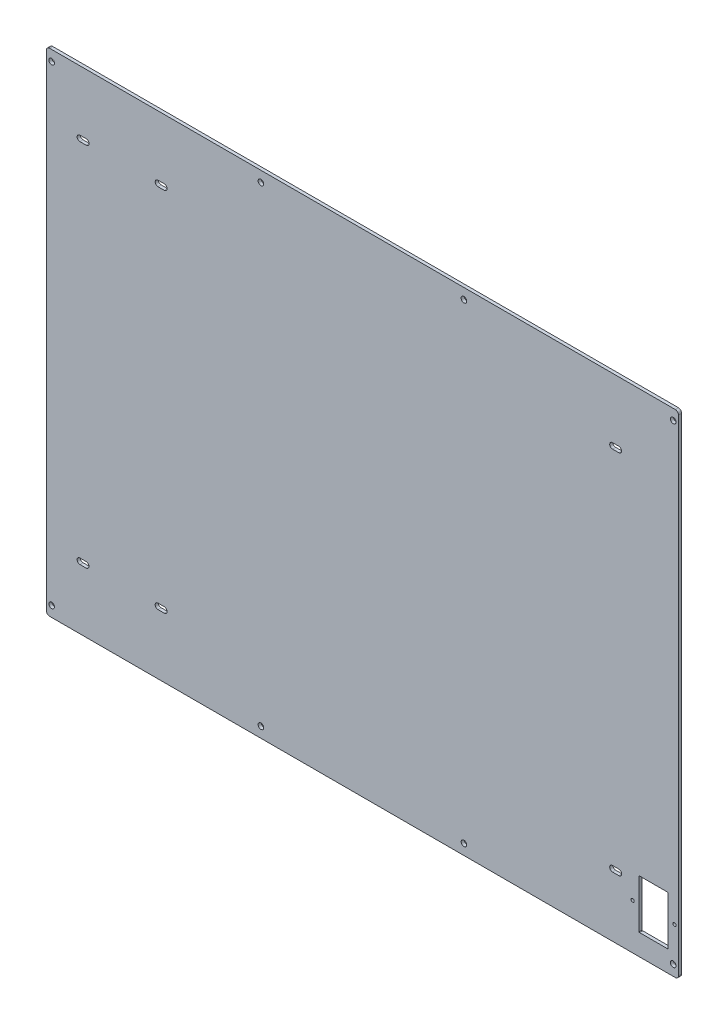
from build123d import *

# Parameters (mm, degrees)
SKETCH1_W              = 604
SKETCH1_H              = 470
BOSS_EXTRUDE1_DEPTH    = 3
FILLET1_R              = 3
M5_CLEARANCE_HOLE1_D   = 5.5
SKETCH5_R              = 1.6
SKETCH5_W              = 28
SKETCH5_H              = 47
CUT_EXTRUDE1_DEPTH     = 766.326727614
FILLET2_R              = 0.5
CUT_EXTRUDE5_DEPTH     = 766.326727614
MOVE_FACE1_OUTLINE_R   = 2.75
MOVE_FACE1_OUTLINE_R_2 = 2.6738
MOVE_FACE1_OUTLINE_R_3 = 1.6
MOVE_FACE1_OUTLINE_R_4 = 1.5238
MOVE_FACE1_DEPTH       = 3


# Read off the part's stored shape, not the designer's step: Move Face1
with BuildPart() as part:
    # Sketch1 → Boss-Extrude1 (new body)
    with BuildSketch(Plane.XY):
        with Locations((302, 235)):
            Rectangle(SKETCH1_W, SKETCH1_H)
    extrude(amount=BOSS_EXTRUDE1_DEPTH)

    # Fillet1
    fillet1_edges = [part.edges().sort_by_distance(p)[0] for p in [
        (0, 470, 1.5),
        (604, 470, 1.5),
        (604, 0, 1.5),
        (0, 0, 1.5),
    ]]
    fillet(fillet1_edges, radius=FILLET1_R)

    # M5 Clearance Hole1 (through all)
    with Locations(Plane(origin=(0, 0, 0), x_dir=(-1, 0, 0), z_dir=(0, 0, -1))):
        with Locations((-599, 460), (-399, 460), (-205, 460), (-5, 460), (-5, 10), (-205, 10), (-399, 10), (-599, 10), (-544, 410), (-544, 60), (-35, 410), (-35, 60), (-109.625, 410), (-109.625, 60)):
            Hole(M5_CLEARANCE_HOLE1_D / 2)

    # Sketch5 → Cut-Extrude1 (cut, through all)
    with BuildSketch(Plane.XY.offset(3)):
        with Locations((560.25, 43.5)):
            Circle(SKETCH5_R)
        with Locations(Location((600.25, 43.5, 0), (0, 0, 180))):
            Circle(SKETCH5_R)
        with Locations((580.25, 43.5)):
            Rectangle(SKETCH5_W, SKETCH5_H)
    extrude(amount=-CUT_EXTRUDE1_DEPTH, mode=Mode.SUBTRACT)

    # Fillet2
    fillet2_edges = [part.edges().sort_by_distance(p)[0] for p in [
        (566.25, 20, 1.5),
        (566.25, 67, 1.5),
        (594.25, 67, 1.5),
        (594.25, 20, 1.5),
    ]]
    fillet(fillet2_edges, radius=FILLET2_R)

    # Sketch9 → Cut-Extrude5 (cut, through all)
    with BuildSketch(Plane.XY.offset(3)):
        with BuildLine():
            Line((32, 412.75), (38, 412.75))
            ThreePointArc((38, 412.75), (40.75, 410), (38, 407.25))
            Line((38, 407.25), (32, 407.25))
            ThreePointArc((32, 407.25), (29.25, 410), (32, 412.75))
        make_face()
        with BuildLine():
            Line((106.625, 412.75), (112.625, 412.75))
            ThreePointArc((112.625, 412.75), (115.375, 410), (112.625, 407.25))
            Line((112.625, 407.25), (106.625, 407.25))
            ThreePointArc((106.625, 407.25), (103.875, 410), (106.625, 412.75))
        make_face()
        with BuildLine():
            Line((32, 62.75), (38, 62.75))
            ThreePointArc((38, 62.75), (40.75, 60), (38, 57.25))
            Line((38, 57.25), (32, 57.25))
            ThreePointArc((32, 57.25), (29.25, 60), (32, 62.75))
        make_face()
        with BuildLine():
            Line((106.625, 62.75), (112.625, 62.75))
            ThreePointArc((112.625, 62.75), (115.375, 60), (112.625, 57.25))
            Line((112.625, 57.25), (106.625, 57.25))
            ThreePointArc((106.625, 57.25), (103.875, 60), (106.625, 62.75))
        make_face()
        with BuildLine():
            Line((541, 412.75), (547, 412.75))
            ThreePointArc((547, 412.75), (549.75, 410), (547, 407.25))
            Line((547, 407.25), (541, 407.25))
            ThreePointArc((541, 407.25), (538.25, 410), (541, 412.75))
        make_face()
        with BuildLine():
            Line((541, 62.75), (547, 62.75))
            ThreePointArc((547, 62.75), (549.75, 60), (547, 57.25))
            Line((547, 57.25), (541, 57.25))
            ThreePointArc((541, 57.25), (538.25, 60), (541, 62.75))
        make_face()
    extrude(amount=-CUT_EXTRUDE5_DEPTH, mode=Mode.SUBTRACT)

    # Move Face1 outline → Move Face1 (add)
    # profile 1 of 18: a face of its own
    with BuildSketch(Plane.XY):
        with BuildLine():
            Line((-0.0762, 467), (-0.0762, 3))
            ThreePointArc((-0.0762, 3), (0.82479812, 0.82479812), (3, -0.0762))
            Line((3, -0.0762), (601, -0.0762))
            ThreePointArc((601, -0.0762), (603.17520188, 0.82479812), (604.0762, 3))
            Line((604.0762, 3), (604.0762, 467))
            ThreePointArc((604.0762, 467), (603.17520188, 469.17520188), (601, 470.0762))
            Line((601, 470.0762), (3, 470.0762))
            ThreePointArc((3, 470.0762), (0.82479812, 469.17520188), (-0.0762, 467))
        make_face()
        with BuildLine():
            ThreePointArc((3, 0), (0.878679656, 0.878679656), (0, 3))
            Line((0, 3), (0, 467))
            ThreePointArc((0, 467), (0.878679656, 469.121320344), (3, 470))
            Line((3, 470), (601, 470))
            ThreePointArc((601, 470), (603.121320344, 469.121320344), (604, 467))
            Line((604, 467), (604, 3))
            ThreePointArc((604, 3), (603.121320344, 0.878679656), (601, 0))
            Line((601, 0), (3, 0))
        make_face(mode=Mode.SUBTRACT)
    # profile 2 of 18: a face of its own
    with BuildSketch(Plane.XY):
        with Locations((599, 10)):
            Circle(MOVE_FACE1_OUTLINE_R)
        with Locations((599, 10)):
            Circle(MOVE_FACE1_OUTLINE_R_2, mode=Mode.SUBTRACT)
    # profile 3 of 18: a face of its own
    with BuildSketch(Plane.XY):
        with Locations((399, 10)):
            Circle(MOVE_FACE1_OUTLINE_R)
        with Locations((399, 10)):
            Circle(MOVE_FACE1_OUTLINE_R_2, mode=Mode.SUBTRACT)
    # profile 4 of 18: a face of its own
    with BuildSketch(Plane.XY):
        with Locations((205, 10)):
            Circle(MOVE_FACE1_OUTLINE_R)
        with Locations((205, 10)):
            Circle(MOVE_FACE1_OUTLINE_R_2, mode=Mode.SUBTRACT)
    # profile 5 of 18: a face of its own
    with BuildSketch(Plane.XY):
        with Locations((5, 10)):
            Circle(MOVE_FACE1_OUTLINE_R)
        with Locations((5, 10)):
            Circle(MOVE_FACE1_OUTLINE_R_2, mode=Mode.SUBTRACT)
    # profile 6 of 18: a face of its own
    with BuildSketch(Plane.XY):
        with Locations((5, 460)):
            Circle(MOVE_FACE1_OUTLINE_R)
        with Locations((5, 460)):
            Circle(MOVE_FACE1_OUTLINE_R_2, mode=Mode.SUBTRACT)
    # profile 7 of 18: a face of its own
    with BuildSketch(Plane.XY):
        with Locations((205, 460)):
            Circle(MOVE_FACE1_OUTLINE_R)
        with Locations((205, 460)):
            Circle(MOVE_FACE1_OUTLINE_R_2, mode=Mode.SUBTRACT)
    # profile 8 of 18: a face of its own
    with BuildSketch(Plane.XY):
        with Locations((399, 460)):
            Circle(MOVE_FACE1_OUTLINE_R)
        with Locations((399, 460)):
            Circle(MOVE_FACE1_OUTLINE_R_2, mode=Mode.SUBTRACT)
    # profile 9 of 18: a face of its own
    with BuildSketch(Plane.XY):
        with Locations((599, 460)):
            Circle(MOVE_FACE1_OUTLINE_R)
        with Locations((599, 460)):
            Circle(MOVE_FACE1_OUTLINE_R_2, mode=Mode.SUBTRACT)
    # profile 10 of 18: a face of its own
    with BuildSketch(Plane.XY):
        with BuildLine():
            ThreePointArc((566.75, 67), (566.396446609, 66.853553391), (566.25, 66.5))
            Line((566.25, 66.5), (566.25, 20.5))
            ThreePointArc((566.25, 20.5), (566.396446609, 20.146446609), (566.75, 20))
            Line((566.75, 20), (593.75, 20))
            ThreePointArc((593.75, 20), (594.103553391, 20.146446609), (594.25, 20.5))
            Line((594.25, 20.5), (594.25, 66.5))
            ThreePointArc((594.25, 66.5), (594.103553391, 66.853553391), (593.75, 67))
            Line((593.75, 67), (566.75, 67))
        make_face()
        with BuildLine():
            Line((566.3262, 20.5), (566.3262, 66.5))
            ThreePointArc((566.3262, 66.5), (566.450328146, 66.799671854), (566.75, 66.9238))
            Line((566.75, 66.9238), (593.75, 66.9238))
            ThreePointArc((593.75, 66.9238), (594.049671854, 66.799671854), (594.1738, 66.5))
            Line((594.1738, 66.5), (594.1738, 20.5))
            ThreePointArc((594.1738, 20.5), (594.049671854, 20.200328146), (593.75, 20.0762))
            Line((593.75, 20.0762), (566.75, 20.0762))
            ThreePointArc((566.75, 20.0762), (566.450328146, 20.200328146), (566.3262, 20.5))
        make_face(mode=Mode.SUBTRACT)
    # profile 11 of 18: a face of its own
    with BuildSketch(Plane.XY):
        with Locations((560.25, 43.5)):
            Circle(MOVE_FACE1_OUTLINE_R_3)
        with Locations((560.25, 43.5)):
            Circle(MOVE_FACE1_OUTLINE_R_4, mode=Mode.SUBTRACT)
    # profile 12 of 18: a face of its own
    with BuildSketch(Plane.XY):
        with Locations((600.25, 43.5)):
            Circle(MOVE_FACE1_OUTLINE_R_3)
        with Locations((600.25, 43.5)):
            Circle(MOVE_FACE1_OUTLINE_R_4, mode=Mode.SUBTRACT)
    # profile 13 of 18: a face of its own
    with BuildSketch(Plane.XY):
        with BuildLine():
            ThreePointArc((38, 407.25), (40.75, 410), (38, 412.75))
            Line((38, 412.75), (32, 412.75))
            ThreePointArc((32, 412.75), (29.25, 410), (32, 407.25))
            Line((32, 407.25), (38, 407.25))
        make_face()
        with BuildLine():
            Line((32, 412.6738), (38, 412.6738))
            ThreePointArc((38, 412.6738), (40.6738, 410), (38, 407.3262))
            Line((38, 407.3262), (32, 407.3262))
            ThreePointArc((32, 407.3262), (29.3262, 410), (32, 412.6738))
        make_face(mode=Mode.SUBTRACT)
    # profile 14 of 18: a face of its own
    with BuildSketch(Plane.XY):
        with BuildLine():
            ThreePointArc((112.625, 407.25), (115.375, 410), (112.625, 412.75))
            Line((112.625, 412.75), (106.625, 412.75))
            ThreePointArc((106.625, 412.75), (103.875, 410), (106.625, 407.25))
            Line((106.625, 407.25), (112.625, 407.25))
        make_face()
        with BuildLine():
            Line((106.625, 412.6738), (112.625, 412.6738))
            ThreePointArc((112.625, 412.6738), (115.2988, 410), (112.625, 407.3262))
            Line((112.625, 407.3262), (106.625, 407.3262))
            ThreePointArc((106.625, 407.3262), (103.9512, 410), (106.625, 412.6738))
        make_face(mode=Mode.SUBTRACT)
    # profile 15 of 18: a face of its own
    with BuildSketch(Plane.XY):
        with BuildLine():
            ThreePointArc((547, 407.25), (549.75, 410), (547, 412.75))
            Line((547, 412.75), (541, 412.75))
            ThreePointArc((541, 412.75), (538.25, 410), (541, 407.25))
            Line((541, 407.25), (547, 407.25))
        make_face()
        with BuildLine():
            Line((541, 412.6738), (547, 412.6738))
            ThreePointArc((547, 412.6738), (549.6738, 410), (547, 407.3262))
            Line((547, 407.3262), (541, 407.3262))
            ThreePointArc((541, 407.3262), (538.3262, 410), (541, 412.6738))
        make_face(mode=Mode.SUBTRACT)
    # profile 16 of 18: a face of its own
    with BuildSketch(Plane.XY):
        with BuildLine():
            ThreePointArc((547, 57.25), (549.75, 60), (547, 62.75))
            Line((547, 62.75), (541, 62.75))
            ThreePointArc((541, 62.75), (538.25, 60), (541, 57.25))
            Line((541, 57.25), (547, 57.25))
        make_face()
        with BuildLine():
            Line((541, 62.6738), (547, 62.6738))
            ThreePointArc((547, 62.6738), (549.6738, 60), (547, 57.3262))
            Line((547, 57.3262), (541, 57.3262))
            ThreePointArc((541, 57.3262), (538.3262, 60), (541, 62.6738))
        make_face(mode=Mode.SUBTRACT)
    # profile 17 of 18: a face of its own
    with BuildSketch(Plane.XY):
        with BuildLine():
            ThreePointArc((38, 57.25), (40.75, 60), (38, 62.75))
            Line((38, 62.75), (32, 62.75))
            ThreePointArc((32, 62.75), (29.25, 60), (32, 57.25))
            Line((32, 57.25), (38, 57.25))
        make_face()
        with BuildLine():
            Line((32, 62.6738), (38, 62.6738))
            ThreePointArc((38, 62.6738), (40.6738, 60), (38, 57.3262))
            Line((38, 57.3262), (32, 57.3262))
            ThreePointArc((32, 57.3262), (29.3262, 60), (32, 62.6738))
        make_face(mode=Mode.SUBTRACT)
    # profile 18 of 18: a face of its own
    with BuildSketch(Plane.XY):
        with BuildLine():
            ThreePointArc((112.625, 57.25), (115.375, 60), (112.625, 62.75))
            Line((112.625, 62.75), (106.625, 62.75))
            ThreePointArc((106.625, 62.75), (103.875, 60), (106.625, 57.25))
            Line((106.625, 57.25), (112.625, 57.25))
        make_face()
        with BuildLine():
            Line((106.625, 62.6738), (112.625, 62.6738))
            ThreePointArc((112.625, 62.6738), (115.2988, 60), (112.625, 57.3262))
            Line((112.625, 57.3262), (106.625, 57.3262))
            ThreePointArc((106.625, 57.3262), (103.9512, 60), (106.625, 62.6738))
        make_face(mode=Mode.SUBTRACT)
    extrude(amount=MOVE_FACE1_DEPTH)


solid = part.part
